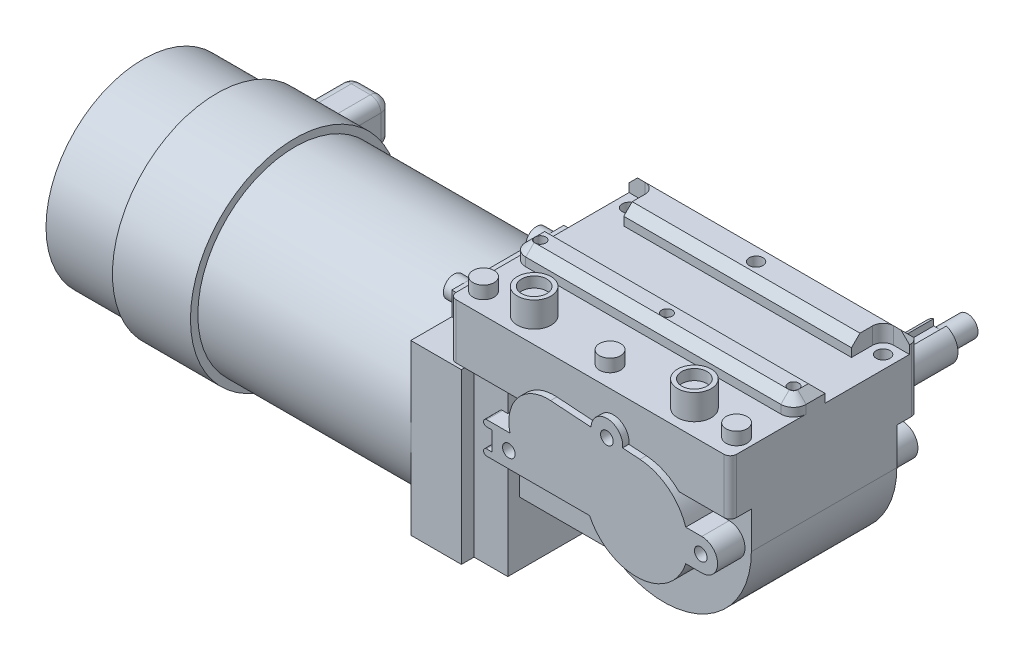
from build123d import *

# Parameters (mm, degrees)
BOSS_EXTRUDE1_DEPTH      = 9
BOSS_EXTRUDE1_DEPTH_BACK = 17
SKETCH1_W                = 133
SKETCH1_H                = 89
SKETCH2_R                = 5
BOSS_EXTRUDE2_DEPTH      = 6
SKETCH3_R                = 8
BOSS_EXTRUDE3_DEPTH      = 12
SKETCH4_R                = 6
CUT_EXTRUDE1_DEPTH       = 5
BOSS_EXTRUDE4_DEPTH      = 8
CHAMFER1_SIZE            = 4
SKETCH7_W                = 133
SKETCH7_H                = 19
BOSS_EXTRUDE5_DEPTH      = 8
CHAMFER2_SIZE            = 4
CUT_EXTRUDE2_DEPTH       = 8
FILLET1_R                = 3
BOSS_EXTRUDE6_DEPTH      = 3
BOSS_EXTRUDE6_DEPTH_BACK = 92
BOSS_EXTRUDE7_DEPTH      = 69
SKETCH13_R               = 3
CUT_EXTRUDE3_DEPTH       = 16
CUT_EXTRUDE7_START       = 16
SKETCH14_R               = 3
CUT_EXTRUDE7_DEPTH       = 16
SKETCH15_W               = 80
SKETCH15_H               = 80
BOSS_EXTRUDE8_DEPTH      = 16
BOSS_EXTRUDE9_DEPTH      = 24
SKETCH17_R               = 46
BOSS_EXTRUDE10_DEPTH     = 101
SKETCH18_R               = 49.5
BOSS_EXTRUDE11_DEPTH     = 37
SKETCH19_R               = 46
BOSS_EXTRUDE12_DEPTH     = 35
BOSS_EXTRUDE13_DEPTH     = 9
SKETCH21_W               = 30
SKETCH21_H               = 21
BOSS_EXTRUDE14_DEPTH     = 19
SKETCH22_R               = 10.5
BOSS_EXTRUDE15_DEPTH     = 3
SKETCH23_R               = 8.5
BOSS_EXTRUDE16_DEPTH     = 46
SKETCH24_W               = 6
SKETCH24_H               = 4
CUT_EXTRUDE8_DEPTH       = 42
SKETCH6_R                = 2.5
CUT_EXTRUDE10_DEPTH      = 14
SKETCH10_R               = 3.25
CUT_EXTRUDE11_DEPTH      = 30
SKETCH26_R               = 5
BOSS_EXTRUDE21_DEPTH     = 13
SKETCH27_R               = 5
BOSS_EXTRUDE22_DEPTH     = 6
FILLET3_R                = 5
FILLET4_R                = 5
FILLET6_R                = 5


with BuildPart() as part:
    # Sketch1 → Boss-Extrude1 (new, two sides: drawn at the far end of the back side and taken through both)
    with BuildSketch(Plane(origin=(0, 0, 0), x_dir=(1, 0, 0), z_dir=(0, 1, 0)).offset(-BOSS_EXTRUDE1_DEPTH_BACK)):
        with Locations((52.200156848, -34.600108587)):
            Rectangle(SKETCH1_W, SKETCH1_H)
    extrude(amount=BOSS_EXTRUDE1_DEPTH + BOSS_EXTRUDE1_DEPTH_BACK)

    # Sketch2 → Boss-Extrude2 (add)
    with BuildSketch(Plane(origin=(0, 9, 0), x_dir=(1, 0, 0), z_dir=(0, 1, 0))):
        with Locations(Location((111.700156848, -69.100108587, 0), (0, 0, 270))):
            Circle(SKETCH2_R)
        with Locations(Location((-8.299843152, -69.100108587, 0), (0, 0, 270))):
            Circle(SKETCH2_R)
        with Locations(Location((51.700156848, -69.100108587, 0), (0, 0, 270))):
            Circle(SKETCH2_R)
    extrude(amount=BOSS_EXTRUDE2_DEPTH)

    # Sketch3 → Boss-Extrude3 (add)
    with BuildSketch(Plane(origin=(0, 9, 0), x_dir=(1, 0, 0), z_dir=(0, 1, 0))):
        with Locations(Location((89.700156848, -67.100108587, 0), (0, 0, 270))):
            Circle(SKETCH3_R)
        with Locations(Location((13.700156848, -67.100108587, 0), (0, 0, 270))):
            Circle(SKETCH3_R)
    extrude(amount=BOSS_EXTRUDE3_DEPTH)

    # Sketch4 → Cut-Extrude1 (cut)
    with BuildSketch(Plane(origin=(0, 21, 0), x_dir=(1, 0, 0), z_dir=(0, 1, 0))):
        with Locations(Location((89.700156848, -67.100108587, 0), (0, 0, 270))):
            Circle(SKETCH4_R)
        with Locations(Location((13.700156848, -67.100108587, 0), (0, 0, 270))):
            Circle(SKETCH4_R)
    extrude(amount=-CUT_EXTRUDE1_DEPTH, mode=Mode.SUBTRACT)

    # Sketch5 → Boss-Extrude4 (add)
    with BuildSketch(Plane(origin=(0, 9, 0), x_dir=(1, 0, 0), z_dir=(0, 1, 0))):
        with BuildLine():
            Line((-14.299843152, -34.100108587), (118.700156848, -34.100108587))
            Line((118.700156848, -34.100108587), (118.700156848, -43.100108587))
            ThreePointArc((118.700156848, -43.100108587), (116.942797535, -47.342749274), (112.700156848, -49.100108587))
            Line((112.700156848, -49.100108587), (-8.299843152, -49.100108587))
            ThreePointArc((-8.299843152, -49.100108587), (-12.542483839, -47.342749274), (-14.299843152, -43.100108587))
            Line((-14.299843152, -43.100108587), (-14.299843152, -34.100108587))
        make_face()
    extrude(amount=BOSS_EXTRUDE4_DEPTH)

    # Chamfer1
    chamfer1_edges = [part.edges().sort_by_distance(p)[0] for p in [
        (-14.299843152, 17, 38.600108587),
        (-12.542483839, 17, 47.342749274),
        (52.200156848, 17, 49.100108587),
        (116.942797535, 17, 47.342749274),
        (118.700156848, 17, 38.600108587),
        (52.200156848, 17, 34.100108587),
    ]]
    chamfer(chamfer1_edges, length=CHAMFER1_SIZE)

    # Sketch7 → Boss-Extrude5 (add)
    with BuildSketch(Plane(origin=(0, 9, 0), x_dir=(1, 0, 0), z_dir=(0, 1, 0))):
        with Locations((52.200156848, 0.399891413)):
            Rectangle(SKETCH7_W, SKETCH7_H)
    extrude(amount=BOSS_EXTRUDE5_DEPTH)

    # Chamfer2
    chamfer2_edges = [part.edges().sort_by_distance(p)[0] for p in [
        (118.700156848, 17, -0.399891413),
        (52.200156848, 17, -9.899891413),
        (-14.299843152, 17, -0.399891413),
        (52.200156848, 17, 9.100108587),
    ]]
    chamfer(chamfer2_edges, length=CHAMFER2_SIZE)

    # Sketch9 → Cut-Extrude2 (cut)
    with BuildSketch(Plane(origin=(0, 17, 0), x_dir=(1, 0, 0), z_dir=(0, 1, 0))):
        with BuildLine():
            Line((111.200156848, 5.899891413), (132.962767939, 5.899891413))
            Line((132.962767939, 5.899891413), (132.962767939, -16.467469914))
            Line((132.962767939, -16.467469914), (106.200156848, -16.467469914))
            Line((106.200156848, -16.467469914), (106.200156848, 0.899891413))
            ThreePointArc((106.200156848, 0.899891413), (107.664622942, 4.435425319), (111.200156848, 5.899891413))
        make_face()
        with BuildLine():
            Line((-28.674590313, 5.899891413), (-6.799843152, 5.899891413))
            ThreePointArc((-6.799843152, 5.899891413), (-3.264309246, 4.435425319), (-1.799843152, 0.899891413))
            Line((-1.799843152, 0.899891413), (-1.799843152, -10.681291545))
            Line((-1.799843152, -10.681291545), (-28.674590313, -10.681291545))
            Line((-28.674590313, -10.681291545), (-28.674590313, 5.899891413))
        make_face()
    extrude(amount=-CUT_EXTRUDE2_DEPTH, mode=Mode.SUBTRACT)

    # Fillet1
    fillet1_edges = [part.edges().sort_by_distance(p)[0] for p in [
        (-14.299843152, -2, -9.899891413),
        (118.700156848, -2, -9.899891413),
        (118.700156848, -4, 79.100108587),
        (-14.299843152, -4, 79.100108587),
    ]]
    fillet(fillet1_edges, radius=FILLET1_R)

    # Sketch11 → Boss-Extrude6 (add, two sides: drawn at the far end of the back side and taken through both)
    with BuildSketch(Plane.XY.offset(79.100108587).offset(-BOSS_EXTRUDE6_DEPTH_BACK)):
        with BuildLine():
            Line((36.481554964, -7.044431223), (55.701134984, -8.378875798))
            ThreePointArc((55.701134984, -8.378875798), (63.719642571, -1.018012658), (70.643962967, -9.416378996))
            Line((70.643962967, -9.416378996), (78.90194115, -9.989742939))
            ThreePointArc((78.90194115, -9.989742939), (92.359934757, -15.165318603), (100.59671153, -27))
            Line((100.59671153, -27), (108.200156848, -27))
            ThreePointArc((108.200156848, -27), (115.700156848, -34.5), (108.200156848, -42))
            Line((108.200156848, -42), (100.59671153, -42))
            ThreePointArc((100.59671153, -42), (78.82913398, -59.015203538), (55.001631966, -45.029684898))
            Line((55.001631966, -45.029684898), (8.700156848, -45.029684898))
            Line((8.700156848, -45.029684898), (6.200156848, -45.029684898))
            ThreePointArc((6.200156848, -45.029684898), (4.710999469, -43.540527519), (6.200156848, -42.051370139))
            Line((6.200156848, -42.051370139), (8.700156848, -42.051370139))
            Line((8.700156848, -42.051370139), (8.700156848, -33.007999658))
            Line((8.700156848, -33.007999658), (6.200156848, -33.007999658))
            ThreePointArc((6.200156848, -33.007999658), (4.710999469, -31.518842278), (6.200156848, -30.029684898))
            Line((6.200156848, -30.029684898), (8.700156848, -30.029684898))
            Line((8.700156848, -30.029684898), (17.263268748, -30.029684898))
            ThreePointArc((17.263268748, -30.029684898), (21.007489436, -13.633315892), (36.481554964, -7.044431223))
        make_face()
    extrude(amount=BOSS_EXTRUDE6_DEPTH + BOSS_EXTRUDE6_DEPTH_BACK)

    # Sketch12 → Boss-Extrude7 (add)
    with BuildSketch(Plane.XY.offset(69.100108587)):
        with BuildLine():
            Line((118.700156848, -14.345477845), (118.700156848, -34.5))
            ThreePointArc((118.700156848, -34.5), (95.266890933, -71.86098392), (51.43060892, -67.029684898))
            Line((51.43060892, -67.029684898), (8.700156848, -67.029684898))
            Line((8.700156848, -67.029684898), (8.700156848, -17))
            Line((8.700156848, -17), (39.570381404, -17))
            ThreePointArc((39.570381404, -17), (75.710561644, 6.973257723), (113.477494633, -14.345477845))
            Line((113.477494633, -14.345477845), (118.700156848, -14.345477845))
        make_face()
    extrude(amount=-BOSS_EXTRUDE7_DEPTH)

    # Sketch13 → Cut-Extrude3 (cut)
    with BuildSketch(Plane.XY.offset(82.100108587)):
        with Locations((63.200156848, -9.018012658)):
            Circle(SKETCH13_R)
        with Locations((107.700156848, -34.5)):
            Circle(SKETCH13_R)
        with Locations((16.700156848, -37.529684898)):
            Circle(SKETCH13_R)
    extrude(amount=-CUT_EXTRUDE3_DEPTH, mode=Mode.SUBTRACT)

    # Sketch14 → Cut-Extrude7 (cut)
    with BuildSketch(Plane.XY.offset(-12.899891413).offset(CUT_EXTRUDE7_START)):
        with Locations((63.200156848, -9.018012658)):
            Circle(SKETCH14_R)
        with Locations((107.700156848, -34.5)):
            Circle(SKETCH14_R)
        with Locations((16.700156848, -37.529684898)):
            Circle(SKETCH14_R)
    extrude(amount=-CUT_EXTRUDE7_DEPTH, mode=Mode.SUBTRACT)

    # Sketch15 → Boss-Extrude8 (add)
    with BuildSketch(Plane.ZY.offset(-8.700156848)):
        with Locations((34.600108587, -57)):
            Rectangle(SKETCH15_W, SKETCH15_H)
    extrude(amount=BOSS_EXTRUDE8_DEPTH)

    # Sketch16 → Boss-Extrude9 (add)
    with BuildSketch(Plane.ZY.offset(7.299843152)):
        Polygon((-11.399891413, -17), (8.037669063, -17), (8.037669063, -6), (61.162548111, -6), (61.162548111, -17), (80.600108587, -17), (80.600108587, -97), (63.600108587, -97), (63.600108587, -107), (5.600108587, -107), (5.600108587, -97), (-11.399891413, -97), align=None)
    extrude(amount=BOSS_EXTRUDE9_DEPTH)

    # Sketch17 → Boss-Extrude10 (add)
    with BuildSketch(Plane.ZY.offset(31.299843152)):
        with Locations((34.600108587, -57)):
            Circle(SKETCH17_R)
    extrude(amount=BOSS_EXTRUDE10_DEPTH)

    # Sketch18 → Boss-Extrude11 (add)
    with BuildSketch(Plane.ZY.offset(132.299843152)):
        with Locations((34.600108587, -57)):
            Circle(SKETCH18_R)
    extrude(amount=BOSS_EXTRUDE11_DEPTH)

    # Sketch19 → Boss-Extrude12 (add)
    with BuildSketch(Plane.ZY.offset(169.299843152)):
        with Locations((34.600108587, -57)):
            Circle(SKETCH19_R)
    extrude(amount=BOSS_EXTRUDE12_DEPTH)

    # Sketch20 → Boss-Extrude13 (add)
    with BuildSketch(Plane.ZY.offset(169.299843152)):
        Polygon((-9.217696013, -43), (-9.217696013, -71), (-15.217696013, -66), (-15.217696013, -48), align=None)
    extrude(amount=BOSS_EXTRUDE13_DEPTH)

    # Sketch21 → Boss-Extrude14 (add)
    with BuildSketch(Plane.ZY.offset(166.299843152)):
        with Locations((-30.217696013, -57)):
            Rectangle(SKETCH21_W, SKETCH21_H)
    extrude(amount=BOSS_EXTRUDE14_DEPTH)

    # Sketch22 → Boss-Extrude15 (add)
    with BuildSketch(Plane(origin=(0, 0, -12.899891413), x_dir=(-1, 0, 0), z_dir=(0, 0, -1))):
        with Locations(Location((-77.200156848, -34.5, 0), (0, 0, 180))):
            Circle(SKETCH22_R)
    extrude(amount=BOSS_EXTRUDE15_DEPTH)

    # Sketch23 → Boss-Extrude16 (add)
    with BuildSketch(Plane(origin=(0, 0, -15.899891413), x_dir=(-1, 0, 0), z_dir=(0, 0, -1))):
        with Locations((-77.200156848, -34.5)):
            Circle(SKETCH23_R)
    extrude(amount=BOSS_EXTRUDE16_DEPTH)

    # Sketch24 → Cut-Extrude8 (cut)
    with BuildSketch(Plane(origin=(0, 0, -61.899891413), x_dir=(-1, 0, 0), z_dir=(0, 0, -1))):
        with Locations((-77.200156848, -27.54701314)):
            Rectangle(SKETCH24_W, SKETCH24_H)
    extrude(amount=-CUT_EXTRUDE8_DEPTH, mode=Mode.SUBTRACT)

    # Sketch6 → Cut-Extrude10 (cut)
    with BuildSketch(Plane(origin=(0, 17, 0), x_dir=(1, 0, 0), z_dir=(0, 1, 0))):
        with Locations(Location((112.200156848, -42.600108587, 0), (0, 0, 270))):
            Circle(SKETCH6_R)
        with Locations(Location((-7.799843152, -42.600108587, 0), (0, 0, 270))):
            Circle(SKETCH6_R)
        with Locations(Location((52.200156848, -42.600108587, 0), (0, 0, 270))):
            Circle(SKETCH6_R)
    extrude(amount=-CUT_EXTRUDE10_DEPTH, mode=Mode.SUBTRACT)

    # Sketch10 → Cut-Extrude11 (cut)
    with BuildSketch(Plane(origin=(0, 17, 0), x_dir=(1, 0, 0), z_dir=(0, 1, 0))):
        with Locations(Location((112.450156848, -0.350108587, 0), (0, 0, 270))):
            Circle(SKETCH10_R)
        with Locations(Location((52.200156848, -0.350108587, 0), (0, 0, 270))):
            Circle(SKETCH10_R)
        with Locations(Location((-8.049843152, -0.350108587, 0), (0, 0, 270))):
            Circle(SKETCH10_R)
    extrude(amount=-CUT_EXTRUDE11_DEPTH, mode=Mode.SUBTRACT)

    # Sketch26 → Boss-Extrude21 (add)
    with BuildSketch(Plane(origin=(0, 0, -61.899891413), x_dir=(-1, 0, 0), z_dir=(0, 0, -1))):
        with Locations(Location((-77.200156848, -34.5, 0), (0, 0, 97.863269065))):
            Circle(SKETCH26_R)
    extrude(amount=BOSS_EXTRUDE21_DEPTH)

    # Sketch27 → Boss-Extrude22 (add)
    with BuildSketch(Plane.ZY.offset(31.299843152)):
        with Locations((54.162548111, -11)):
            Circle(SKETCH27_R)
        with Locations((15.037669063, -11)):
            Circle(SKETCH27_R)
        with Locations((56.600108587, -102)):
            Circle(SKETCH27_R)
        with Locations((12.600108587, -102)):
            Circle(SKETCH27_R)
    extrude(amount=BOSS_EXTRUDE22_DEPTH)

    # Fillet3
    fillet3_edges = [part.edges().sort_by_distance(p)[0] for p in [
        (-166.299843152, -46.5, -30.217696013),
        (-175.799843152, -46.5, -45.217696013),
        (-185.299843152, -46.5, -30.217696013),
    ]]
    fillet(fillet3_edges, radius=FILLET3_R)

    # Fillet4
    # the kernel refuses this fillet: 5 mm, written as the material it takes off along each edge
    with BuildSketch(Plane(origin=(-171.299843152, -51.5, -40.217696013), x_dir=(0, 0, -1), z_dir=(1, 0, 0))) as fillet4_piece_1_section:
        Polygon((0, 0), (FILLET4_R * 1.02, 0), (FILLET4_R * 1.02, FILLET4_R * 1.02), (0, FILLET4_R * 1.02), align=None)
    fillet4_piece_1 = extrude(amount=FILLET4_R * 1.02, mode=Mode.PRIVATE)
    fillet4_piece_1 = fillet4_piece_1 - Plane(origin=(-171.299843152, -51.5, -40.217696013), x_dir=(0, -0.7071067811865472, 0.7071067811865478), z_dir=(1, 0, 0)) * Sphere(FILLET4_R, mode=Mode.PRIVATE)
    add(fillet4_piece_1, mode=Mode.SUBTRACT)
    with BuildSketch(Plane(origin=(-180.299843152, -51.5, -40.217696013), x_dir=(0, 0, -1), z_dir=(-1, 0, 0))) as fillet4_piece_2_section:
        Polygon((0, 0), (FILLET4_R * 1.02, 0), (FILLET4_R * 1.02, -FILLET4_R * 1.02), (0, -FILLET4_R * 1.02), align=None)
    fillet4_piece_2 = extrude(amount=FILLET4_R * 1.02, mode=Mode.PRIVATE)
    fillet4_piece_2 = fillet4_piece_2 - Plane(origin=(-180.299843152, -51.5, -40.217696013), x_dir=(0, -0.7071067811865472, 0.7071067811865478), z_dir=(-1, 0, 0)) * Sphere(FILLET4_R, mode=Mode.PRIVATE)
    add(fillet4_piece_2, mode=Mode.SUBTRACT)
    with BuildSketch(Plane(origin=(-180.299843152, -62.5, -40.217696013), x_dir=(0, -1, 0), z_dir=(0, 0, -1))) as fillet4_piece_3_section:
        Polygon((0, 0), (FILLET4_R * 1.02, 0), (FILLET4_R * 1.02, FILLET4_R * 1.02), (0, FILLET4_R * 1.02), align=None)
    fillet4_piece_3 = extrude(amount=FILLET4_R * 1.02, mode=Mode.PRIVATE)
    fillet4_piece_3 = fillet4_piece_3 - Plane(origin=(-180.299843152, -62.5, -40.217696013), x_dir=(0.7071067811865475, 0.7071067811865475, 0), z_dir=(0, 0, -1)) * Sphere(FILLET4_R, mode=Mode.PRIVATE)
    add(fillet4_piece_3, mode=Mode.SUBTRACT)
    with BuildSketch(Plane(origin=(-185.299843152, -80, -15.217696013), x_dir=(1, 0, 0), z_dir=(0, 1, 0)), Plane(origin=(-166.299843152, -51.5, -45.217696013), x_dir=(0, 0, 1), z_dir=(0, -1, 0))) as fillet4_piece_4:
        with BuildLine():
            CenterArc((FILLET4_R, FILLET4_R), FILLET4_R, 180, 90)
            Line((0, FILLET4_R), (0, 0))
            Line((0, 0), (FILLET4_R, 0))
        make_face()
    extrude(amount=28.5, mode=Mode.SUBTRACT)
    with BuildSketch(Plane(origin=(-185.299843152, -67.5, -40.217696013), x_dir=(1, 0, 0), z_dir=(0, 0, 1))) as fillet4_piece_5:
        with BuildLine():
            CenterArc((FILLET4_R, FILLET4_R), FILLET4_R, 180, 90)
            Line((0, FILLET4_R), (0, 0))
            Line((0, 0), (FILLET4_R, 0))
        make_face()
    extrude(amount=25, mode=Mode.SUBTRACT)
    with BuildSketch(Plane(origin=(-153.799843152, -67.5, -45.217696013), x_dir=(0, 0, 1), z_dir=(-1, 0, 0))) as fillet4_piece_6:
        with BuildLine():
            CenterArc((FILLET4_R, FILLET4_R), FILLET4_R, 180, 90)
            Line((0, FILLET4_R), (0, 0))
            Line((0, 0), (FILLET4_R, 0))
        make_face()
    extrude(amount=26.5, mode=Mode.SUBTRACT)
    with BuildSketch(Plane(origin=(-185.299843152, -51.5, -45.217696013), x_dir=(0, 0, 1), z_dir=(0, -1, 0))) as fillet4_piece_7:
        with BuildLine():
            CenterArc((FILLET4_R, -FILLET4_R), FILLET4_R, 90, 90)
            Line((0, -FILLET4_R), (0, 0))
            Line((0, 0), (FILLET4_R, 0))
        make_face()
    extrude(amount=11, mode=Mode.SUBTRACT)
    with BuildSketch(Plane(origin=(-166.299843152, -80, -15.217696013), x_dir=(-1, 0, 0), z_dir=(0, 1, 0))) as fillet4_piece_8_section:
        with BuildLine():
            CenterArc((FILLET4_R, -FILLET4_R), FILLET4_R, 90, 90)
            Line((0, -FILLET4_R), (0, 0))
            Line((0, 0), (FILLET4_R, 0))
        make_face()
    fillet4_piece_8 = extrude(amount=28.5, mode=Mode.PRIVATE)
    fillet4_piece_8 = split(fillet4_piece_8, bisect_by=Plane(origin=(-169.78475496, -66.221883345, -14.951435999), z_dir=(0, -0.7682212795973747, -0.6401843996644815)), keep=Keep.TOP, mode=Mode.PRIVATE)
    add(fillet4_piece_8, mode=Mode.SUBTRACT)
    with BuildSketch(Plane(origin=(-166.299843152, -80, -15.217696013), x_dir=(-1, 0, 0), z_dir=(0, 1, 0))) as fillet4_piece_9_section:
        with BuildLine():
            CenterArc((FILLET4_R, -FILLET4_R), FILLET4_R, 90, 90)
            Line((0, -FILLET4_R), (0, 0))
            Line((0, 0), (FILLET4_R, 0))
        make_face()
    fillet4_piece_9 = extrude(amount=28.5, mode=Mode.PRIVATE)
    fillet4_piece_9 = split(fillet4_piece_9, bisect_by=Plane(origin=(-169.299843152, -59.563001463, -16.378211505), z_dir=(1, 0, 0)), keep=Keep.TOP, mode=Mode.PRIVATE)
    add(fillet4_piece_9, mode=Mode.SUBTRACT)
    with BuildSketch(Plane(origin=(-171.299843152, -46.5, -15.217696013), x_dir=(0, 0, -1), z_dir=(-1, 0, 0))) as fillet4_piece_10_section:
        with BuildLine():
            CenterArc((FILLET4_R, FILLET4_R), FILLET4_R, 180, 90)
            Line((0, FILLET4_R), (0, 0))
            Line((0, 0), (FILLET4_R, 0))
        make_face()
    fillet4_piece_10 = extrude(amount=9, mode=Mode.PRIVATE)
    fillet4_piece_10 = split(fillet4_piece_10, bisect_by=Plane(origin=(-175.608021003, -48.343594472, -15.63000938), z_dir=(0, 0.7682212795973755, -0.6401843996644804)), keep=Keep.TOP, mode=Mode.PRIVATE)
    add(fillet4_piece_10, mode=Mode.SUBTRACT)
    with BuildSketch(Plane(origin=(-171.299843152, -46.5, -15.217696013), x_dir=(0, 0, -1), z_dir=(-1, 0, 0))) as fillet4_piece_11_section:
        with BuildLine():
            CenterArc((FILLET4_R, FILLET4_R), FILLET4_R, 180, 90)
            Line((0, FILLET4_R), (0, 0))
            Line((0, 0), (FILLET4_R, 0))
        make_face()
    fillet4_piece_11 = extrude(amount=9, mode=Mode.PRIVATE)
    fillet4_piece_11 = split(fillet4_piece_11, bisect_by=Plane(origin=(-178.299843152, -49.133213684, -15.478092034), z_dir=(-1, 0, 0)), keep=Keep.TOP, mode=Mode.PRIVATE)
    add(fillet4_piece_11, mode=Mode.SUBTRACT)
    with BuildSketch(Plane(origin=(-180.299843152, -51.5, -15.217696013), x_dir=(0, 1, 0), z_dir=(1, 0, 0))) as fillet4_piece_12:
        with BuildLine():
            CenterArc((5 - FILLET4_R, -FILLET4_R), FILLET4_R, 360, 90)
            Line((5, -FILLET4_R), (5, 0))
            Line((5, 0), (5 - FILLET4_R, 0))
        make_face()
    revolve(axis=Axis((-180.299843152, -51.5, -15.217696013), (0, 0, 1)), revolution_arc=90, mode=Mode.SUBTRACT)
    with BuildSketch(Plane(origin=(-171.299843152, -51.5, -15.217696013), x_dir=(0, 1, 0), z_dir=(-1, 0, 0))) as fillet4_piece_13_section:
        with BuildLine():
            CenterArc((5 - FILLET4_R, FILLET4_R), FILLET4_R, 270, 90)
            Line((5, FILLET4_R), (5, 0))
            Line((5, 0), (5 - FILLET4_R, 0))
        make_face()
    fillet4_piece_13 = revolve(axis=Axis((-171.299843152, -51.5, -15.217696013), (0, 0, -1)), revolution_arc=90, mode=Mode.PRIVATE)
    fillet4_piece_13 = split(fillet4_piece_13, bisect_by=Plane(origin=(-170.303905592, -48.409213099, -15.708751732), z_dir=(0, 0.7682212795973755, -0.6401843996644804)), keep=Keep.TOP, mode=Mode.PRIVATE)
    add(fillet4_piece_13, mode=Mode.SUBTRACT)
    with BuildSketch(Plane(origin=(-171.299843152, -51.5, -15.217696013), x_dir=(0, 1, 0), z_dir=(-1, 0, 0))) as fillet4_piece_14_section:
        with BuildLine():
            CenterArc((5 - FILLET4_R, FILLET4_R), FILLET4_R, 270, 90)
            Line((5, FILLET4_R), (5, 0))
            Line((5, 0), (5 - FILLET4_R, 0))
        make_face()
    fillet4_piece_14 = revolve(axis=Axis((-171.299843152, -51.5, -15.217696013), (0, 0, -1)), revolution_arc=90, mode=Mode.PRIVATE)
    fillet4_piece_14 = split(fillet4_piece_14, bisect_by=Plane(origin=(-169.299843152, -50.172025327, -16.145154625), z_dir=(1, 0, 0)), keep=Keep.TOP, mode=Mode.PRIVATE)
    add(fillet4_piece_14, mode=Mode.SUBTRACT)

    # Fillet6
    # the kernel refuses this fillet: 5 mm, written as the material it takes off along each edge
    with BuildSketch(Plane(origin=(-171.299843152, -62.5, -40.217696013), x_dir=(1, 0, 0), z_dir=(0, -1, 0))) as fillet6_piece_1_section:
        Polygon((0, 0), (FILLET6_R, 0), (FILLET6_R, -FILLET6_R), (0, -FILLET6_R), align=None)
    fillet6_piece_1 = extrude(amount=FILLET6_R, mode=Mode.PRIVATE)
    fillet6_piece_1 = fillet6_piece_1 - Plane(origin=(-171.299843152, -62.5, -40.217696013), x_dir=(-0.7071067811865475, 0, 0.7071067811865475), z_dir=(0, -1, 0)) * Sphere(FILLET6_R, mode=Mode.PRIVATE)
    add(fillet6_piece_1, mode=Mode.SUBTRACT)
    with BuildSketch(Plane(origin=(-180.299843152, -62.5, -20.217696013), x_dir=(0, -1, 0), z_dir=(0, 0, 1))) as fillet6_piece_2_section:
        Polygon((0, 0), (FILLET6_R, 0), (FILLET6_R, -FILLET6_R), (0, -FILLET6_R), align=None)
    fillet6_piece_2 = extrude(amount=FILLET6_R, mode=Mode.PRIVATE)
    fillet6_piece_2 = fillet6_piece_2 - Plane(origin=(-180.299843152, -62.5, -20.217696013), x_dir=(0.7071067811865475, 0.7071067811865475, 0), z_dir=(0, 0, 1)) * Sphere(FILLET6_R, mode=Mode.PRIVATE)
    add(fillet6_piece_2, mode=Mode.SUBTRACT)
    with BuildSketch(Plane(origin=(-166.299843152, -67.5, -40.217696013), x_dir=(-1, 0, 0), z_dir=(0, 0, 1))) as fillet6_piece_3:
        with BuildLine():
            CenterArc((FILLET6_R, -FILLET6_R), FILLET6_R, 90, 90)
            Line((0, -FILLET6_R), (0, 0))
            Line((0, 0), (FILLET6_R, 0))
        make_face()
    extrude(amount=20, mode=Mode.SUBTRACT)
    with BuildSketch(Plane(origin=(-171.299843152, -67.5, -15.217696013), x_dir=(0, 1, 0), z_dir=(-1, 0, 0))) as fillet6_piece_4_section:
        with BuildLine():
            CenterArc((FILLET6_R, FILLET6_R), FILLET6_R, 180, 90)
            Line((0, FILLET6_R), (0, 0))
            Line((0, 0), (FILLET6_R, 0))
        make_face()
    fillet6_piece_4 = extrude(amount=9, mode=Mode.PRIVATE)
    fillet6_piece_4 = split(fillet6_piece_4, bisect_by=Plane(origin=(-178.299843152, -66.840362131, -16.62137205), z_dir=(1, 0, 0)), keep=Keep.TOP, mode=Mode.PRIVATE)
    fillet6_piece_4 = split(fillet6_piece_4, bisect_by=Plane(origin=(-174.799843152, -65.654078232, -15.632802134), z_dir=(0, -0.7682212795973747, -0.6401843996644815)), keep=Keep.TOP, mode=Mode.PRIVATE)
    add(fillet6_piece_4, mode=Mode.SUBTRACT)
    with BuildSketch(Plane(origin=(-171.299843152, -67.5, -15.217696013), x_dir=(0, 1, 0), z_dir=(-1, 0, 0))) as fillet6_piece_5_section:
        with BuildLine():
            CenterArc((FILLET6_R, FILLET6_R), FILLET6_R, 180, 90)
            Line((0, FILLET6_R), (0, 0))
            Line((0, 0), (FILLET6_R, 0))
        make_face()
    fillet6_piece_5 = extrude(amount=9, mode=Mode.PRIVATE)
    fillet6_piece_5 = split(fillet6_piece_5, bisect_by=Plane(origin=(-178.299843152, -64.718043943, -15.400561522), z_dir=(-1, 0, 0)), keep=Keep.TOP, mode=Mode.PRIVATE)
    fillet6_piece_5 = split(fillet6_piece_5, bisect_by=Plane(origin=(-179.299843152, -65.384674317, -15.956086833), z_dir=(0, 0.7682212795973747, 0.6401843996644815)), keep=Keep.TOP, mode=Mode.PRIVATE)
    add(fillet6_piece_5, mode=Mode.SUBTRACT)
    with BuildSketch(Plane(origin=(-171.299843152, -67.5, -15.217696013), x_dir=(0, 1, 0), z_dir=(-1, 0, 0))) as fillet6_piece_6_section:
        with BuildLine():
            CenterArc((FILLET6_R, FILLET6_R), FILLET6_R, 180, 90)
            Line((0, FILLET6_R), (0, 0))
            Line((0, 0), (FILLET6_R, 0))
        make_face()
    fillet6_piece_6 = extrude(amount=9, mode=Mode.PRIVATE)
    fillet6_piece_6 = split(fillet6_piece_6, bisect_by=Plane(origin=(-178.299843152, -66.840362131, -16.62137205), z_dir=(-1, 0, 0)), keep=Keep.TOP, mode=Mode.PRIVATE)
    fillet6_piece_6 = split(fillet6_piece_6, bisect_by=Plane(origin=(-179.299843152, -65.654078232, -15.632802134), z_dir=(0, -0.7682212795973747, -0.6401843996644815)), keep=Keep.TOP, mode=Mode.PRIVATE)
    add(fillet6_piece_6, mode=Mode.SUBTRACT)
    with BuildSketch(Plane(origin=(-171.299843152, -67.5, -20.217696013), x_dir=(1, 0, 0), z_dir=(0, 0, -1))) as fillet6_piece_7_section:
        with BuildLine():
            CenterArc((5 - FILLET6_R, -FILLET6_R), FILLET6_R, 0, 90)
            Line((5 - FILLET6_R, 0), (5, 0))
            Line((5, 0), (5, -FILLET6_R))
        make_face()
    fillet6_piece_7 = revolve(axis=Axis((-171.299843152, -67.5, -20.217696013), (0, -1, 0)), revolution_arc=90, mode=Mode.PRIVATE)
    fillet6_piece_7 = split(fillet6_piece_7, bisect_by=Plane(origin=(-167.740831357, -64.631330351, -16.860099592), z_dir=(0, -0.7682212795973747, -0.6401843996644815)), keep=Keep.TOP, mode=Mode.PRIVATE)
    fillet6_piece_7 = split(fillet6_piece_7, bisect_by=Plane(origin=(-169.299843152, -66.282447751, -18.236030759), z_dir=(1, 0, 0)), keep=Keep.TOP, mode=Mode.PRIVATE)
    add(fillet6_piece_7, mode=Mode.SUBTRACT)
    with BuildSketch(Plane(origin=(-171.299843152, -67.5, -20.217696013), x_dir=(1, 0, 0), z_dir=(0, 0, -1))) as fillet6_piece_8_section:
        with BuildLine():
            CenterArc((5 - FILLET6_R, -FILLET6_R), FILLET6_R, 0, 90)
            Line((5 - FILLET6_R, 0), (5, 0))
            Line((5, 0), (5, -FILLET6_R))
        make_face()
    fillet6_piece_8 = revolve(axis=Axis((-171.299843152, -67.5, -20.217696013), (0, -1, 0)), revolution_arc=90, mode=Mode.PRIVATE)
    fillet6_piece_8 = split(fillet6_piece_8, bisect_by=Plane(origin=(-170.25979085, -65.533432115, -15.777577475), z_dir=(0, -0.7682212795973747, -0.6401843996644815)), keep=Keep.TOP, mode=Mode.PRIVATE)
    fillet6_piece_8 = split(fillet6_piece_8, bisect_by=Plane(origin=(-169.299843152, -66.816376028, -16.846697403), z_dir=(-1, 0, 0)), keep=Keep.TOP, mode=Mode.PRIVATE)
    add(fillet6_piece_8, mode=Mode.SUBTRACT)
    with BuildSketch(Plane(origin=(-171.299843152, -67.5, -20.217696013), x_dir=(1, 0, 0), z_dir=(0, 0, -1))) as fillet6_piece_9_section:
        with BuildLine():
            CenterArc((5 - FILLET6_R, -FILLET6_R), FILLET6_R, 0, 90)
            Line((5 - FILLET6_R, 0), (5, 0))
            Line((5, 0), (5, -FILLET6_R))
        make_face()
    fillet6_piece_9 = revolve(axis=Axis((-171.299843152, -67.5, -20.217696013), (0, -1, 0)), revolution_arc=90, mode=Mode.PRIVATE)
    fillet6_piece_9 = split(fillet6_piece_9, bisect_by=Plane(origin=(-168.17402595, -64.535108184, -16.975566192), z_dir=(0, 0.7682212795973747, 0.6401843996644815)), keep=Keep.TOP, mode=Mode.PRIVATE)
    fillet6_piece_9 = split(fillet6_piece_9, bisect_by=Plane(origin=(-169.299843152, -64.01503023, -16.542167897), z_dir=(1, 0, 0)), keep=Keep.TOP, mode=Mode.PRIVATE)
    add(fillet6_piece_9, mode=Mode.SUBTRACT)


solid = part.part
